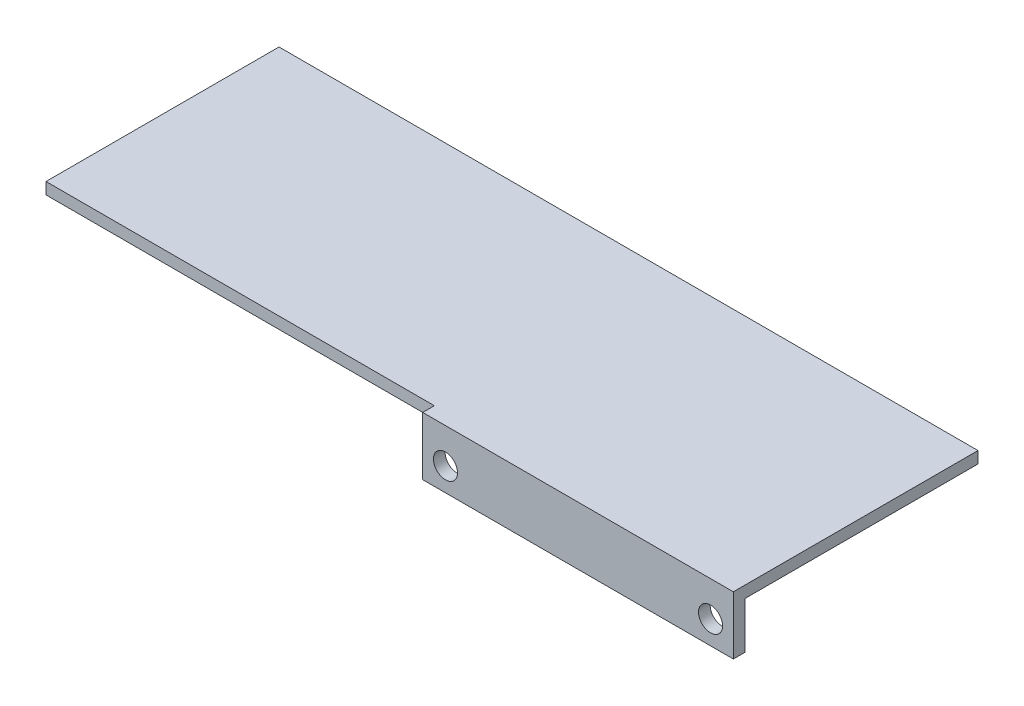
from build123d import *

# Parameters (mm, degrees)
SKETCH_1_W      = 40
SKETCH_1_H      = 6
SKETCH_1_R      = 1.55
EXTRUDE_1_DEPTH = 1.5
SKETCH_2_W      = 40
SKETCH_2_H      = 1.5
EXTRUDE_2_DEPTH = 1.5
SKETCH_4_W      = 40
SKETCH_4_H      = 1.5
EXTRUDE_3_DEPTH = 30
SKETCH_6_W      = 30
SKETCH_6_H      = 1.5
EXTRUDE_4_DEPTH = 50


with BuildPart() as part:
    # 草图1 → 凸台-拉伸1 (new body)
    with BuildSketch(Plane.XY):
        Rectangle(SKETCH_1_W, SKETCH_1_H)
        with Locations((-17.066, 0)):
            Circle(SKETCH_1_R, mode=Mode.SUBTRACT)
        with Locations((17.066, 0)):
            Circle(SKETCH_1_R, mode=Mode.SUBTRACT)
    extrude(amount=EXTRUDE_1_DEPTH)

    # 草图2 → 凸台-拉伸2 (add)
    with BuildSketch(Plane(origin=(0, 3, 0), x_dir=(1, 0, 0), z_dir=(0, 1, 0))):
        with Locations((0, -0.75)):
            Rectangle(SKETCH_2_W, SKETCH_2_H)
    extrude(amount=EXTRUDE_2_DEPTH)

    # 草图4 → 凸台-拉伸3 (add)
    with BuildSketch(Plane(origin=(0, 0, 0), x_dir=(-1, 0, 0), z_dir=(0, 0, -1))):
        with Locations((0, 3.75)):
            Rectangle(SKETCH_4_W, SKETCH_4_H)
    extrude(amount=EXTRUDE_3_DEPTH)

    # 草图6 → 凸台-拉伸4 (add)
    with BuildSketch(Plane.ZY.offset(20)):
        with Locations((-15, 3.75)):
            Rectangle(SKETCH_6_W, SKETCH_6_H)
    extrude(amount=EXTRUDE_4_DEPTH)


solid = part.part
